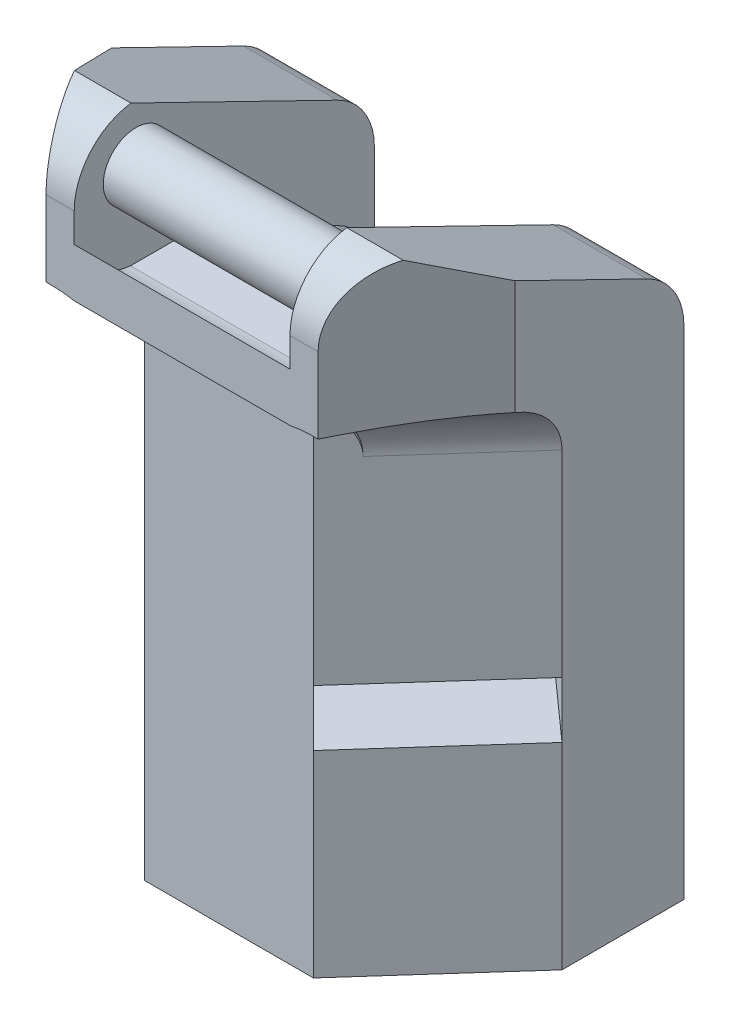
from build123d import *

# Parameters (mm, degrees)
BOSS_EXTRUDE1_DEPTH     = 30
SKETCH6_R               = 7.75
CUT_EXTRUDE3_DEPTH      = 0.5
BOSS_EXTRUDE2_DEPTH     = 15
BOSS_EXTRUDE3_DEPTH     = 15
CHAMFER1_SIZE           = 5
CHAMFER1_SIZE2          = 10.251519208
BOSS_EXTRUDE5_DEPTH     = 15
BOSS_EXTRUDE6_REACH     = 75.607
SKETCH10_R              = 3.5
BOSS_EXTRUDE7_REACH     = 62.698
SKETCH18_W              = 10
SKETCH18_H              = 10.251519208
CUT_EXTRUDE4_DEPTH      = 74.607064878
CUT_EXTRUDE4_DEPTH_BACK = 74.607064878
FILLET4_R               = 7
FILLET5_R               = 7
FILLET6_R               = 7
FILLET7_R               = 7
BOSS_EXTRUDE8_REACH     = 75.607
FILLET9_R               = 7
CUT_EXTRUDE5_DEPTH      = 23
FILLET12_R              = 7
BOSS_EXTRUDE9_REACH     = 75.607
BOSS_EXTRUDE10_START    = 10
SKETCH24_R              = 7.75
BOSS_EXTRUDE10_DEPTH    = 10
SKETCH25_W              = 18.768324379
SKETCH25_H              = 6
CUT_EXTRUDE6_DEPTH      = 10
SKETCH26_W              = 18.768324379
SKETCH26_H              = 6
CUT_EXTRUDE7_DEPTH      = 10


with BuildPart() as part:
    # Sketch1 → Boss-Extrude1 (new body)
    with BuildSketch(Plane(origin=(0, 0, 0), x_dir=(1, 0, 0), z_dir=(0, 1, 0))):
        Polygon((-30.5, 27), (12.5, 27), (12.5, 14), (0, 0), (-18, 0), (-30.5, 14), align=None)
    extrude(amount=BOSS_EXTRUDE1_DEPTH)

    # Sketch6 → Cut-Extrude3 (cut)
    with BuildSketch(Plane.XZ):
        with Locations(Location((-9, -18, 0), (0, 0, 270))):
            Circle(SKETCH6_R)
    extrude(amount=-CUT_EXTRUDE3_DEPTH, mode=Mode.SUBTRACT)

    # Sketch7 → Boss-Extrude2 (add)
    with BuildSketch(Plane(origin=(0, 30, 0), x_dir=(1, 0, 0), z_dir=(0, 1, 0))):
        Polygon((-30.5, 27), (-30.5, 14), (-18, 0), (0, 0), (12.5, 14), (12.5, 27), align=None)
    extrude(amount=BOSS_EXTRUDE2_DEPTH)

    # Sketch8 → Boss-Extrude3 (add)
    with BuildSketch(Plane(origin=(0, 45, 0), x_dir=(1, 0, 0), z_dir=(0, 1, 0))):
        Polygon((-30.5, 27), (-30.5, 9), (-23.5, -5), (-20.5, -5), (-20.5, 27), align=None)
    extrude(amount=BOSS_EXTRUDE3_DEPTH)

    # Chamfer1
    chamfer1_edges = [part.edges().sort_by_distance(p)[0] for p in [
        (-4, 45, -27),
    ]]
    chamfer1_side = [part.faces().sort_by_distance(p)[0] for p in [
        (-10.18705036, 24.658273381, -27),
    ]]
    chamfer(chamfer1_edges, length=CHAMFER1_SIZE, length2=CHAMFER1_SIZE2, reference=chamfer1_side[0])

    # Sketch12 → Boss-Extrude5 (add)
    with BuildSketch(Plane(origin=(0, 45, 0), x_dir=(1, 0, 0), z_dir=(0, 1, 0))):
        Polygon((12.5, 9), (12.5, 27), (2.5, 27), (2.5, -5), (5.5, -5), align=None)
    extrude(amount=BOSS_EXTRUDE5_DEPTH)

    # Sketch10 → Boss-Extrude6 (add, up to next)
    with BuildSketch(Plane(origin=(-20.5, 0, 0), x_dir=(0, 0, -1), z_dir=(1, 0, 0)), mode=Mode.PRIVATE) as boss_extrude6_sk1:
        with Locations(Location((1.594739548, 53.968499846, 0), (0, 0, 180))):
            Circle(SKETCH10_R)
    boss_extrude6_tool1 = extrude(boss_extrude6_sk1.sketch, amount=BOSS_EXTRUDE6_REACH, mode=Mode.PRIVATE) - part.part
    add(boss_extrude6_tool1.solids().sort_by_distance((-20.5, 53.9685, -1.59474))[0])

    # Boss-Extrude7: up to this face of the body (flat: up to its plane)
    boss_extrude7_end = Plane(part.part.faces().sort_by_distance((-4, 42.5, -21.874240396))[0])
    # Sketch18 → Boss-Extrude7 (add, up to the picked face)
    with BuildSketch(Plane.XZ.offset(-45), mode=Mode.PRIVATE) as boss_extrude7_sk1:
        with Locations((7.5, -21.874240396)):
            Rectangle(SKETCH18_W, SKETCH18_H)
    boss_extrude7_tool1 = split(extrude(boss_extrude7_sk1.sketch, amount=BOSS_EXTRUDE7_REACH, mode=Mode.PRIVATE), bisect_by=boss_extrude7_end, keep=Keep.BOTH, mode=Mode.PRIVATE)
    add(boss_extrude7_tool1.solids().sort_by(Axis((7.5, 45, -21.87424), (0, -1, 0)))[0])

    # Sketch19 → Cut-Extrude4 (cut, two sides: drawn at the far end of the back side and taken through both)
    with BuildSketch(Plane(origin=(-20.5, 0, 0), x_dir=(0, 0, -1), z_dir=(1, 0, 0)).offset(-CUT_EXTRUDE4_DEPTH_BACK)):
        Polygon((1.052419117, 60), (27, 47.344519209), (30.679345013, 60.875953777), (1.052419117, 61.751907555), align=None)
    extrude(amount=CUT_EXTRUDE4_DEPTH + CUT_EXTRUDE4_DEPTH_BACK, mode=Mode.SUBTRACT)

    # Fillet4
    # the kernel refuses this fillet: 7 mm, written as the material it takes off along each edge
    with BuildSketch(Plane(origin=(-40.838917655, 60, 5), x_dir=(0, 0, -1), z_dir=(1, 0, 0))) as fillet4_piece_1:
        with BuildLine():
            CenterArc((7, -6.935567062), FILLET4_R, 97.779940417, 82.220059583)
            Line((0, -6.935567062), (-0.14, -6.935567062))
            Line((-0.14, -6.935567062), (-0.14, 0))
            Line((-0.14, 0), (0, 0.14))
            ThreePointArc((0, 0.14), (3.026209558, 0.14), (6.033467499, 0.138711341))
            Line((6.033467499, 0.138711341), (6.052419117, 0))
        make_face()
    extrude(amount=37.677835309, mode=Mode.SUBTRACT)

    # Fillet5
    # the kernel refuses this fillet: 7 mm, written as the material it takes off along each edge
    with BuildSketch(Plane(origin=(-14.838917655, 60, 5), x_dir=(0, 0, -1), z_dir=(1, 0, 0))) as fillet5_piece_1:
        with BuildLine():
            CenterArc((7, -6.935567062), FILLET5_R, 97.779940417, 82.220059583)
            Line((0, -6.935567062), (-0.14, -6.935567062))
            Line((-0.14, -6.935567062), (-0.14, 0))
            Line((-0.14, 0), (0, 0.14))
            ThreePointArc((0, 0.14), (3.026209558, 0.14), (6.033467499, 0.138711341))
            Line((6.033467499, 0.138711341), (6.052419117, 0))
        make_face()
    extrude(amount=37.677835309, mode=Mode.SUBTRACT)

    # Fillet6
    # the kernel refuses this fillet: 7 mm, written as the material it adds along each edge
    with BuildSketch(Plane(origin=(-9.155275963, 45, 10.253909078), x_dir=(0, -1, 0), z_dir=(0.6660157693088524, 0, -0.7459376616259147))) as fillet6_piece_1_section:
        with BuildLine():
            CenterArc((FILLET6_R, -FILLET6_R), FILLET6_R, 90, 90)
            Line((0, -FILLET6_R), (0, 0))
            Line((0, 0), (FILLET6_R, 0))
        make_face()
    fillet6_piece_1 = extrude(amount=50.014659503, mode=Mode.PRIVATE)
    fillet6_piece_1 = split(fillet6_piece_1, bisect_by=Plane(origin=(12.5, 45, 10.253909078), z_dir=(-1, 0, 0)), keep=Keep.TOP, mode=Mode.PRIVATE)
    fillet6_piece_1 = split(fillet6_piece_1, bisect_by=Plane(origin=(2.5, 45, 10.253909078), z_dir=(1, 0, 0)), keep=Keep.TOP, mode=Mode.PRIVATE)
    fillet6_piece_1 = split(fillet6_piece_1, bisect_by=Plane(origin=(0.467381176, 45, 15.065237648), z_dir=(-0.8944271909999162, 0, -0.4472135954999575)), keep=Keep.TOP, mode=Mode.PRIVATE)
    fillet6_piece_1 = split(fillet6_piece_1, bisect_by=Plane(origin=(-9.155275963, 45, 5), z_dir=(0, 0, -1)), keep=Keep.TOP, mode=Mode.PRIVATE)
    add(fillet6_piece_1)

    # Fillet7
    # the kernel refuses this fillet: 7 mm, written as the material it adds along each edge
    with BuildSketch(Plane(origin=(-42.155275963, 45, -27.053909078), x_dir=(-0.7459376616259148, 0, 0.6660157693088522), z_dir=(0.6660157693088522, 0, 0.7459376616259148))) as fillet7_piece_1_section:
        with BuildLine():
            CenterArc((FILLET7_R, FILLET7_R), FILLET7_R, 180, 90)
            Line((0, FILLET7_R), (0, 0))
            Line((0, 0), (FILLET7_R, 0))
        make_face()
    fillet7_piece_1 = extrude(amount=50.014659503, mode=Mode.PRIVATE)
    fillet7_piece_1 = split(fillet7_piece_1, bisect_by=Plane(origin=(-30.5, 45, -27.053909078), z_dir=(1, 0, 0)), keep=Keep.TOP, mode=Mode.PRIVATE)
    fillet7_piece_1 = split(fillet7_piece_1, bisect_by=Plane(origin=(-42.155275963, 45, 5), z_dir=(0, 0, -1)), keep=Keep.TOP, mode=Mode.PRIVATE)
    fillet7_piece_1 = split(fillet7_piece_1, bisect_by=Plane(origin=(-40.052618824, 45, -28.105237648), z_dir=(0.8944271909999161, 0, -0.4472135954999577)), keep=Keep.TOP, mode=Mode.PRIVATE)
    fillet7_piece_1 = split(fillet7_piece_1, bisect_by=Plane(origin=(-20.5, 45, -27.053909078), z_dir=(-1, 0, 0)), keep=Keep.TOP, mode=Mode.PRIVATE)
    add(fillet7_piece_1)

    # Sketch21 → Boss-Extrude8 (add, up to next)
    with BuildSketch(Plane(origin=(-20.5, 0, 0), x_dir=(0, 0, -1), z_dir=(1, 0, 0)), mode=Mode.PRIVATE) as boss_extrude8_sk1:
        with BuildLine():
            Line((2.8, 45), (-5, 45))
            Line((-5, 45), (-5, 44.763260828))
            add(Edge.make_bspline(
                [(2.8, 38), (2.8, 43.376764541), (-5, 44.763260828)],
                knots=[0, 0, 0, 1.309981256, 1.309981256, 1.309981256], degree=2, weights=[1, 0.793053637, 1]))
            Line((2.8, 38), (2.8, 45))
        make_face()
    boss_extrude8_tool1 = extrude(boss_extrude8_sk1.sketch, amount=BOSS_EXTRUDE8_REACH, mode=Mode.PRIVATE) - part.part
    add(boss_extrude8_tool1.solids().sort_by_distance((-20.5, 43.416068, -0.535904))[0])

    # Fillet9
    fillet9_edges = [part.edges().sort_by_distance(p)[0] for p in [
        (-25.5, 47.344519209, -27),
        (7.5, 47.344519209, -27),
        (-9, 40, -27),
    ]]
    fillet(fillet9_edges, radius=FILLET9_R)

    # Sketch22 → Cut-Extrude5 (cut)
    with BuildSketch(Plane.ZY.offset(-2.5)):
        Polygon((5, 51.374505428), (-27, 35.767062594), (-27, 42.970433745), (-2.018410751, 49.666818357), align=None)
    extrude(amount=CUT_EXTRUDE5_DEPTH, mode=Mode.SUBTRACT)

    # Fillet12
    # the kernel refuses this fillet: 7 mm, written as the material it takes off along each edge
    with BuildSketch(Plane(origin=(2.5, 35.767763648, -26.998562626), x_dir=(0, -0.9999999460246048, -0.0003285586515390651), z_dir=(-1, 0, 0))) as fillet12_piece_1:
        with BuildLine():
            CenterArc((4.372486843, 6.999999622), FILLET12_R, 206.018825024, 64)
            Line((-1.918062927, 3.929334614), (-2.547117904, 3.622268114))
            Line((-2.547117904, 3.622268114), (-0.629054977, -0.307066501))
            Line((-0.629054977, -0.307066501), (-0.013954967, -0.699860885))
            ThreePointArc((-0.013954967, -0.699860885), (0.142079567, -0.70139073), (4.375016745, -0.699999962))
            Line((4.375016745, -0.699999962), (4.374786754, 0))
        make_face()
    extrude(amount=23, mode=Mode.SUBTRACT)
    with BuildSketch(Plane(origin=(2.5, 45, -8.069672968), x_dir=(0, -0.438371146789077, -0.8987940462991671), z_dir=(-1, 0, 0))) as fillet12_piece_2:
        with BuildLine():
            CenterArc((FILLET12_R * 0.230868191126, FILLET12_R), FILLET12_R, 244, 26)
            Line((-FILLET12_R * 0.207502955664, FILLET12_R * 0.101205953701), (0, 0))
            Line((0, 0), (FILLET12_R * 0.230868191126, 0))
        make_face()
    extrude(amount=23, mode=Mode.SUBTRACT)

    # Sketch23 → Boss-Extrude9 (add, up to next)
    with BuildSketch(Plane.ZY.offset(-2.5), mode=Mode.PRIVATE) as boss_extrude9_sk1:
        with BuildLine():
            Line((5, 45), (-1, 45))
            ThreePointArc((-1, 45), (2.755309717, 46.57305469), (5, 49.969849895))
            Line((5, 49.969849895), (5, 45))
        make_face()
    boss_extrude9_tool1 = extrude(boss_extrude9_sk1.sketch, amount=BOSS_EXTRUDE9_REACH, mode=Mode.PRIVATE) - part.part
    add(boss_extrude9_tool1.solids().sort_by_distance((2.5, 46.322933, 3.503714))[0])

    # Sketch24 → Boss-Extrude10 (add)
    with BuildSketch(Plane.XZ.offset(BOSS_EXTRUDE10_START)):
        Polygon((-30.5, -14), (-30.5, -27), (12.5, -27), (12.5, -14), (0, 0), (-18, 0), align=None)
        with Locations(Location((-9, -18, 0), (0, 0, 270))):
            Circle(SKETCH24_R, mode=Mode.SUBTRACT)
    extrude(amount=-BOSS_EXTRUDE10_DEPTH)

    # Sketch25 → Cut-Extrude6 (cut)
    with BuildSketch(Plane(origin=(0, 0, 0), x_dir=(0.6660157693088523, 0, -0.7459376616259148), z_dir=(0.7459376616259148, 0, 0.6660157693088523))):
        with Locations((9.38416219, 13.99928604)):
            Rectangle(SKETCH25_W, SKETCH25_H)
    extrude(amount=-CUT_EXTRUDE6_DEPTH, mode=Mode.SUBTRACT)

    # Sketch26 → Cut-Extrude7 (cut)
    with BuildSketch(Plane(origin=(-10.015613911, 0, 8.94251242), x_dir=(0.6660157693088522, 0, 0.7459376616259148), z_dir=(-0.7459376616259148, 0, 0.6660157693088522))):
        with Locations((-21.372446038, 14)):
            Rectangle(SKETCH26_W, SKETCH26_H)
    extrude(amount=-CUT_EXTRUDE7_DEPTH, mode=Mode.SUBTRACT)


solid = part.part
